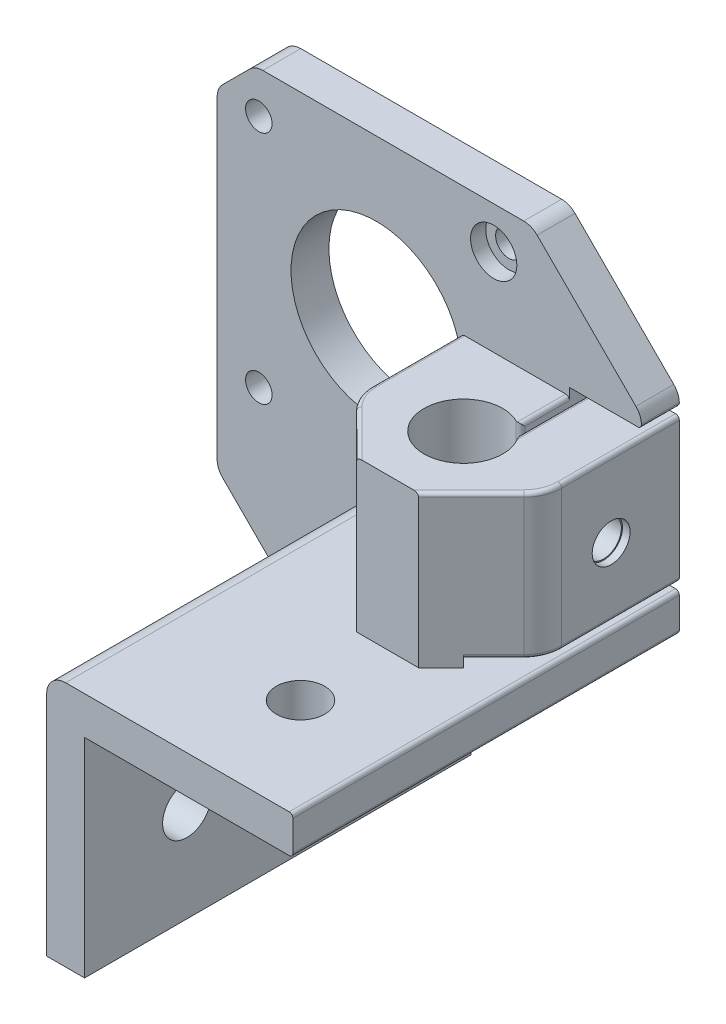
from build123d import *

# Parameters (mm, degrees)
SKETCH1_R           = 11.25
SKETCH1_R_2         = 1.75
BOSS_EXTRUDE1_DEPTH = 5
BOSS_EXTRUDE2_DEPTH = 46
BOSS_EXTRUDE3_DEPTH = 20
CUT_EXTRUDE1_DEPTH  = 1
CUT_EXTRUDE2_DEPTH  = 65.090268372
CUT_EXTRUDE3_REACH  = 71.748
SKETCH6_R           = 2.7
SKETCH6_R_2         = 3.2
CUT_EXTRUDE4_REACH  = 70.949
SKETCH7_R           = 5.2
SKETCH7_R_2         = 3.2
SKETCH8_R           = 3.05
CUT_EXTRUDE5_DEPTH  = 2
FILLET1_R           = 2.5
FILLET2_R           = 5
FILLET3_R           = 0.5


with BuildPart() as part:
    # Sketch1 → Boss-Extrude1 (new body)
    with BuildSketch(Plane.XY):
        Polygon((-13.5, 34.75), (-28, 20.25), (-28, -7.25), (-0.5, -7.25), (-0.5, -34.75), (7, -34.75), (28, -13.75), (28, 29.75), (23, 34.75), align=None)
        with Locations((7, 13.75)):
            Circle(SKETCH1_R, mode=Mode.SUBTRACT)
        with Locations((-8.5, 29.25)):
            Circle(SKETCH1_R_2, mode=Mode.SUBTRACT)
        with Locations(Location((22.5, 29.25, 0), (0, 0, 180))):
            Circle(SKETCH1_R_2, mode=Mode.SUBTRACT)
        with Locations((22.5, -1.75)):
            Circle(SKETCH1_R_2, mode=Mode.SUBTRACT)
    extrude(amount=BOSS_EXTRUDE1_DEPTH)

    # Sketch2 → Boss-Extrude2 (add)
    with BuildSketch(Plane.XY.offset(5)):
        Polygon((-28, -7.25), (-0.5, -7.25), (-0.5, -34.75), (4.5, -34.75), (4.5, -2.25), (-28, -2.25), align=None)
    extrude(amount=BOSS_EXTRUDE2_DEPTH)

    # Sketch3 → Boss-Extrude3 (add)
    with BuildSketch(Plane(origin=(0, -2.25, 0), x_dir=(1, 0, 0), z_dir=(0, 1, 0))):
        with BuildLine():
            Line((-28, -5), (-28, -17.6))
            Line((-28, -17.6), (-19.6, -26))
            Line((-19.6, -26), (-11.4, -26))
            Line((-11.4, -26), (-4.2, -18.8))
            Line((-4.2, -18.8), (-4.2, -5))
            Line((-4.2, -5), (-18.5, -5))
            Line((-18.5, -5), (-18.5, -11.752647884))
            ThreePointArc((-18.5, -11.752647884), (-11.96959369, -19.81788309), (-19.5, -12.677350455))
            Line((-19.5, -12.677350455), (-19.5, -5))
            Line((-19.5, -5), (-28, -5))
        make_face()
    extrude(amount=BOSS_EXTRUDE3_DEPTH)

    # Sketch4 → Cut-Extrude1 (cut)
    with BuildSketch(Plane(origin=(0, -2.25, 0), x_dir=(1, 0, 0), z_dir=(0, 1, 0))):
        with BuildLine():
            Line((-28, -17.6), (-28, 0))
            Line((-28, 0), (-18.5, 0))
            Line((-18.5, 0), (-18.5, -11.752647884))
            ThreePointArc((-18.5, -11.752647884), (-20.681128714, -15.55738815), (-19.176955262, -19.676955262))
            Line((-19.176955262, -19.676955262), (-22.55, -23.05))
            Line((-22.55, -23.05), (-28, -17.6))
        make_face()
    extrude(amount=CUT_EXTRUDE1_DEPTH, mode=Mode.SUBTRACT)

    # Sketch5 → Cut-Extrude2 (cut, through all)
    with BuildSketch(Plane.XY.offset(5)):
        Polygon((-19.5, 17.75), (-28, 17.75), (-28, 18.75), (-18.5, 18.75), (-18.5, -1.25), (-19.5, -1.25), align=None)
    extrude(amount=-CUT_EXTRUDE2_DEPTH, mode=Mode.SUBTRACT)

    # Sketch6 → Cut-Extrude3 (cut, up to next)
    with BuildSketch(Plane(origin=(4.5, 0, 0), x_dir=(0, 0, -1), z_dir=(1, 0, 0)), mode=Mode.PRIVATE) as cut_extrude3_sk1:
        with Locations((-16, -22.25)):
            Circle(SKETCH6_R)
    cut_extrude3_tool1 = extrude(cut_extrude3_sk1.sketch, amount=-CUT_EXTRUDE3_REACH, mode=Mode.PRIVATE) & part.part
    # Sketch6 → Cut-Extrude3 (cut, up to next)
    with BuildSketch(Plane(origin=(4.5, 0, 0), x_dir=(0, 0, -1), z_dir=(1, 0, 0)), mode=Mode.PRIVATE) as cut_extrude3_sk2:
        with Locations((-37.5, -22.25)):
            Circle(SKETCH6_R_2)
    cut_extrude3_tool2 = extrude(cut_extrude3_sk2.sketch, amount=-CUT_EXTRUDE3_REACH, mode=Mode.PRIVATE) & part.part
    add(cut_extrude3_tool1.solids().sort_by_distance((4.5, -22.25, 16))[0], mode=Mode.SUBTRACT)
    add(cut_extrude3_tool2.solids().sort_by_distance((4.5, -22.25, 37.5))[0], mode=Mode.SUBTRACT)

    # Sketch7 → Cut-Extrude4 (cut, up to next)
    with BuildSketch(Plane(origin=(0, -2.25, 0), x_dir=(1, 0, 0), z_dir=(0, 1, 0)), mode=Mode.PRIVATE) as cut_extrude4_sk1:
        with Locations(Location((-15.5, -16, 0), (0, 0, 125.234417985))):
            Circle(SKETCH7_R)
    cut_extrude4_tool1 = extrude(cut_extrude4_sk1.sketch, amount=-CUT_EXTRUDE4_REACH, mode=Mode.PRIVATE) & part.part
    # Sketch7 → Cut-Extrude4 (cut, up to next)
    with BuildSketch(Plane(origin=(0, -2.25, 0), x_dir=(1, 0, 0), z_dir=(0, 1, 0)), mode=Mode.PRIVATE) as cut_extrude4_sk2:
        with Locations(Location((-15.5, -37.5, 0), (0, 0, 270))):
            Circle(SKETCH7_R_2)
    cut_extrude4_tool2 = extrude(cut_extrude4_sk2.sketch, amount=-CUT_EXTRUDE4_REACH, mode=Mode.PRIVATE) & part.part
    add(cut_extrude4_tool1.solids().sort_by_distance((-15.5, -2.25, 16))[0], mode=Mode.SUBTRACT)
    add(cut_extrude4_tool2.solids().sort_by_distance((-15.5, -2.25, 37.5))[0], mode=Mode.SUBTRACT)

    # Sketch8 → Cut-Extrude5 (cut)
    with BuildSketch(Plane.XY.offset(5)):
        with Locations((-8.5, 29.25)):
            Circle(SKETCH8_R)
    extrude(amount=-CUT_EXTRUDE5_DEPTH, mode=Mode.SUBTRACT)

    # Sketch9 → Cut-Revolve1 (revolve, cut)
    with BuildSketch(Plane(origin=(0, 7.75, 0), x_dir=(1, 0, 0), z_dir=(0, 1, 0)), mode=Mode.PRIVATE) as cut_revolve1_sk:
        Polygon((-4.2, -9), (-4.2, -6), (-7.2, -6), (-7.2, -7.25), (-23, -7.25), (-23, -6.65), (-27, -6.65), (-27, -6.5), (-28, -6.5), (-28, -9), align=None)
    revolve(cut_revolve1_sk.sketch.rotate(Axis((-38.14027768, 7.75, 9), (1, 0, 0)), 180), axis=Axis((-38.14027768, 7.75, 9), (1, 0, 0)), mode=Mode.SUBTRACT)

    # Fillet1
    fillet1_edges = [part.edges().sort_by_distance(p)[0] for p in [
        (4.5, -2.25, 28),
        (-28, 20.25, 2.5),
        (7, -34.75, 2.5),
        (28, -13.75, 2.5),
        (28, 29.75, 2.5),
        (23, 34.75, 2.5),
        (-13.5, 34.75, 2.5),
    ]]
    fillet(fillet1_edges, radius=FILLET1_R)

    # Fillet2
    fillet2_edges = [part.edges().sort_by_distance(p)[0] for p in [
        (-28, 8.25, 17.6),
        (-4.2, 7.75, 18.8),
    ]]
    fillet(fillet2_edges, radius=FILLET2_R)

    # Fillet3
    # the kernel refuses this fillet: 0.5 mm, written as the material it takes off along each edge
    with BuildSketch(Plane(origin=(-28, -1.25, 15.528932188), x_dir=(1, 0, 0), z_dir=(0, 0, -1)), Plane(origin=(-28, 17.75, -1.25), x_dir=(1, 0, 0), z_dir=(0, 0, 1))) as fillet3_piece_1:
        with BuildLine():
            CenterArc((FILLET3_R, -FILLET3_R), FILLET3_R, 90, 90)
            Line((0, -FILLET3_R), (0, 0))
            Line((0, 0), (FILLET3_R, 0))
        make_face()
    extrude(amount=16.778932188, mode=Mode.SUBTRACT)
    with BuildSketch(Plane(origin=(-28, 18.75, 6.272209074), x_dir=(0.0007754462768724465, 0.9999996993414906, 0), z_dir=(0, 0, -1))) as fillet3_piece_2:
        with BuildLine():
            CenterArc((0.500387818, 0.499927816), FILLET3_R, 179.955570197, 91.018024984)
            Line((0.000387968, 0.500315539), (-0.049612017, 0.500354311))
            Line((-0.049612017, 0.500354311), (-0.049999985, 3.8772e-05))
            Line((-0.049999985, 3.8772e-05), (-3.8772e-05, -0.049999985))
            ThreePointArc((-3.8772e-05, -0.049999985), (0.464427182, -0.050360153), (0.509733211, -0.049992782))
            Line((0.509733211, -0.049992782), (0.508883629, 0))
        make_face()
    extrude(amount=7.544418147, mode=Mode.SUBTRACT)
    with BuildSketch(Plane(origin=(-28, -7.25, -1.25), x_dir=(0, 1, 0), z_dir=(0, 0, 1))) as fillet3_piece_3:
        with BuildLine():
            CenterArc((FILLET3_R, -FILLET3_R), FILLET3_R, 90, 90)
            Line((0, -FILLET3_R), (0, 0))
            Line((0, 0), (FILLET3_R, 0))
        make_face()
    extrude(amount=53.5, mode=Mode.SUBTRACT)
    with BuildSketch(Plane(origin=(-26.535533906, 17.75, 19.064466094), x_dir=(0, -1, 0), z_dir=(0.707106781186549, 0, 0.707106781186546))) as fillet3_piece_4:
        with BuildLine():
            CenterArc((FILLET3_R, FILLET3_R), FILLET3_R, 180, 90)
            Line((0, FILLET3_R), (0, 0))
            Line((0, 0), (FILLET3_R, 0))
        make_face()
    extrude(amount=11.058326112, mode=Mode.SUBTRACT)
    with BuildSketch(Plane(origin=(-22.55, -1.25, 23.05), x_dir=(0, 1, 0), z_dir=(-0.7071067811865489, 0, -0.7071067811865461))) as fillet3_piece_5:
        with BuildLine():
            CenterArc((FILLET3_R, FILLET3_R), FILLET3_R, 180, 90)
            Line((0, FILLET3_R), (0, 0))
            Line((0, 0), (FILLET3_R, 0))
        make_face()
    extrude(amount=5.636396103, mode=Mode.SUBTRACT)
    with BuildSketch(Plane(origin=(-23, -1.25, 15.528932188), x_dir=(-0.7071067811865456, 0, 0.7071067811865495), z_dir=(0.7071067811865495, 0, 0.7071067811865456))) as fillet3_piece_6:
        with BuildLine():
            CenterArc((5 - FILLET3_R, -FILLET3_R), FILLET3_R, 0, 90)
            Line((5, -FILLET3_R), (5, 0))
            Line((5, 0), (5 - FILLET3_R, 0))
        make_face()
    revolve(axis=Axis((-23, -1.25, 15.528932188), (0, -1, 0)), revolution_arc=45, mode=Mode.SUBTRACT)
    with BuildSketch(Plane(origin=(-4.2, 17.75, 16.728932188), x_dir=(0, -1, 0), z_dir=(0, 0, -1))) as fillet3_piece_7:
        with BuildLine():
            CenterArc((FILLET3_R, FILLET3_R), FILLET3_R, 180, 90)
            Line((0, FILLET3_R), (0, 0))
            Line((0, 0), (FILLET3_R, 0))
        make_face()
    extrude(amount=11.728932188, mode=Mode.SUBTRACT)
    with BuildSketch(Plane(origin=(-9.2, 17.75, 16.728932188), x_dir=(1, 0, 0), z_dir=(0, 0, -1))) as fillet3_piece_8:
        with BuildLine():
            CenterArc((5 - FILLET3_R, FILLET3_R), FILLET3_R, 270, 90)
            Line((5 - FILLET3_R, 0), (5, 0))
            Line((5, 0), (5, FILLET3_R))
        make_face()
    revolve(axis=Axis((-9.2, 17.75, 16.728932188), (0, -1, 0)), revolution_arc=45, mode=Mode.SUBTRACT)
    with BuildSketch(Plane(origin=(-23, 17.75, 15.528932188), x_dir=(-0.7071067811865456, 0, 0.7071067811865495), z_dir=(0.7071067811865495, 0, 0.7071067811865456))) as fillet3_piece_9:
        with BuildLine():
            CenterArc((5 - FILLET3_R, FILLET3_R), FILLET3_R, 270, 90)
            Line((5, FILLET3_R), (5, 0))
            Line((5, 0), (5 - FILLET3_R, 0))
        make_face()
    revolve(axis=Axis((-23, 17.75, 15.528932188), (0, -1, 0)), revolution_arc=45, mode=Mode.SUBTRACT)
    with BuildSketch(Plane(origin=(-28, -2.25, 52.25), x_dir=(1, 0, 0), z_dir=(0, 0, -1))) as fillet3_piece_10:
        with BuildLine():
            CenterArc((FILLET3_R, FILLET3_R), FILLET3_R, 180, 90)
            Line((0, FILLET3_R), (0, 0))
            Line((0, 0), (FILLET3_R, 0))
        make_face()
    extrude(amount=53.5, mode=Mode.SUBTRACT)
    with BuildSketch(Plane(origin=(-18.5, -2.25, 11.752647884), x_dir=(0, 0, -1), z_dir=(0, 1, 0))) as fillet3_piece_11:
        with BuildLine():
            CenterArc((0.875147274, -0.5), FILLET3_R, 90, 116.014366)
            ThreePointArc((0.425805222, -0.719298246), (0.22737913, -0.351079413), (0, 0))
            Line((0, 0), (0.875147274, 0))
        make_face()
    extrude(amount=22.187868184, mode=Mode.SUBTRACT)
    with BuildSketch(Plane(origin=(-12.283883476, 17.75, 26.883883476), x_dir=(0, -1, 0), z_dir=(0.7071067811865485, 0, -0.7071067811865467))) as fillet3_piece_12:
        with BuildLine():
            CenterArc((FILLET3_R, FILLET3_R), FILLET3_R, 180, 90)
            Line((0, FILLET3_R), (0, 0))
            Line((0, 0), (FILLET3_R, 0))
        make_face()
    extrude(amount=9.361269837, mode=Mode.SUBTRACT)
    with BuildSketch(Plane(origin=(-18.5, 17.75, 5), x_dir=(0, -1, 0), z_dir=(0, 0, 1))) as fillet3_piece_13:
        with BuildLine():
            CenterArc((FILLET3_R, FILLET3_R), FILLET3_R, 180, 90)
            Line((0, FILLET3_R), (0, 0))
            Line((0, 0), (FILLET3_R, 0))
        make_face()
    extrude(amount=8.002647884, mode=Mode.SUBTRACT)
    with BuildSketch(Plane(origin=(-19.5, 17.75, 13.927350455), x_dir=(-1, 0, 0), z_dir=(0, 0, -1))) as fillet3_piece_14:
        with BuildLine():
            CenterArc((FILLET3_R, -FILLET3_R), FILLET3_R, 90, 90)
            Line((0, -FILLET3_R), (0, 0))
            Line((0, 0), (FILLET3_R, 0))
        make_face()
    extrude(amount=15.177350455, mode=Mode.SUBTRACT)
    with BuildSketch(Plane(origin=(-19.5, -1.25, 13.927350455), x_dir=(-1, 0, 0), z_dir=(0, 0, -1))) as fillet3_piece_15:
        with BuildLine():
            CenterArc((FILLET3_R, FILLET3_R), FILLET3_R, 180, 90)
            Line((0, FILLET3_R), (0, 0))
            Line((0, 0), (FILLET3_R, 0))
        make_face()
    extrude(amount=15.177350455, mode=Mode.SUBTRACT)


with BuildPart() as body_2:
    # Mirror1: mirrored copy
    add(part.part.mirror(Plane(origin=(0, 0, 0), x_dir=(0, 0, 1), z_dir=(1, 0, 0))))


solid = body_2.part
